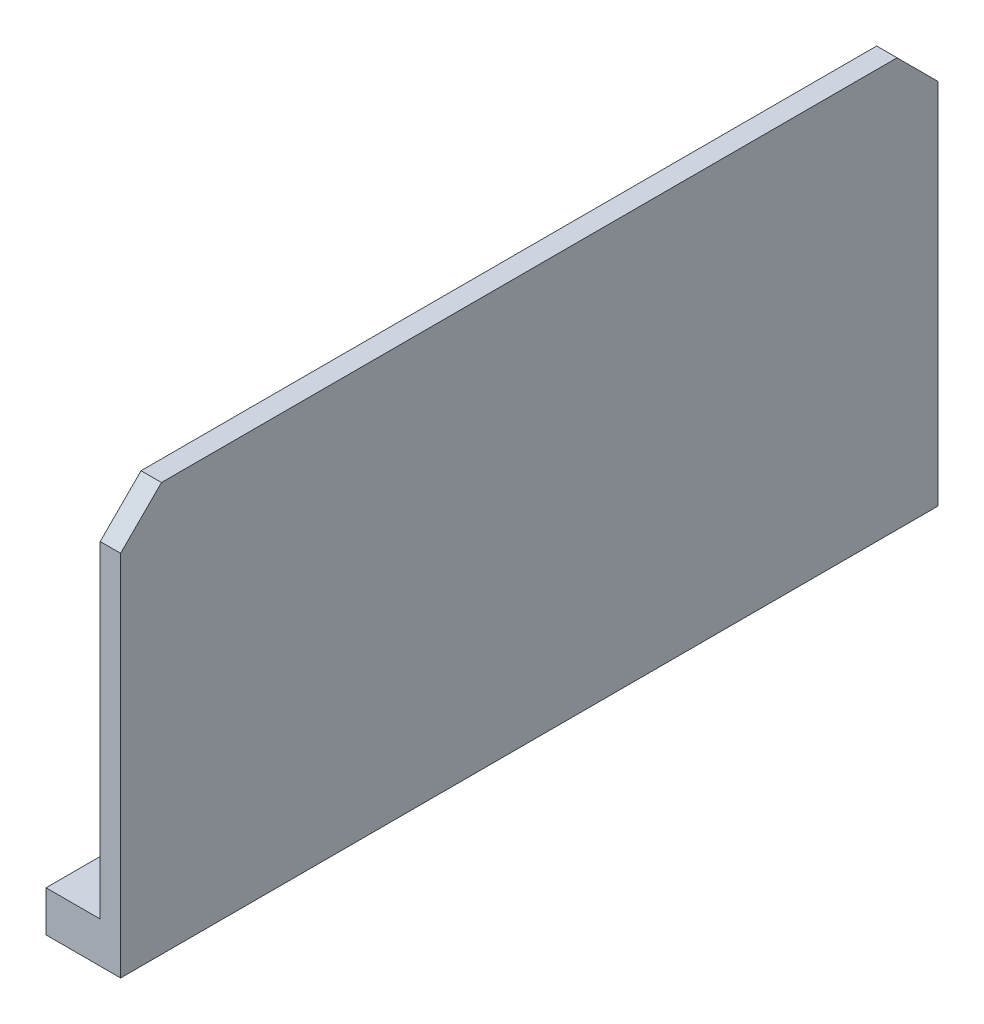
from build123d import *

# Parameters (mm, degrees)
SKETCH_1_W      = 7.3
SKETCH_1_H      = 80
SKETCH_1_R      = 1.5
EXTRUDE_1_DEPTH = 4
SKETCH_1_4_W    = 2
SKETCH_1_4_H    = 80
EXTRUDE_3_DEPTH = 40
EXTRUDE_4_DEPTH = 1
CHAMFER_1_SIZE  = 4


with BuildPart() as part:
    # 草图1 → 凸台-拉伸1 (new body)
    with BuildSketch(Plane(origin=(0, 0, 0), x_dir=(1, 0, 0), z_dir=(0, 1, 0))):
        with Locations((1.25, 0)):
            Rectangle(SKETCH_1_W, SKETCH_1_H)
        with Locations((0, 35)):
            Circle(SKETCH_1_R, mode=Mode.SUBTRACT)
        with Locations((0, -35)):
            Circle(SKETCH_1_R, mode=Mode.SUBTRACT)
    extrude(amount=EXTRUDE_1_DEPTH)

    # 草图1<4> → 凸台-拉伸3 (add)
    with BuildSketch(Plane(origin=(0, 0, 0), x_dir=(1, 0, 0), z_dir=(0, 1, 0))):
        with Locations((3.9, 0)):
            Rectangle(SKETCH_1_4_W, SKETCH_1_4_H)
    extrude(amount=EXTRUDE_3_DEPTH)

    # 草图2 → 凸台-拉伸4 (add, symmetric)
    with BuildSketch(Plane.XY):
        Polygon((2.9, 0), (2.9, 40), (-7.1, 4), (-7.1, 0), align=None)
    extrude(amount=EXTRUDE_4_DEPTH, both=True)

    # 倒角1
    chamfer_1_edges = [part.edges().sort_by_distance(p)[0] for p in [
        (3.9, 40, 40),
        (3.9, 40, -40),
    ]]
    chamfer(chamfer_1_edges, length=CHAMFER_1_SIZE)


solid = part.part
